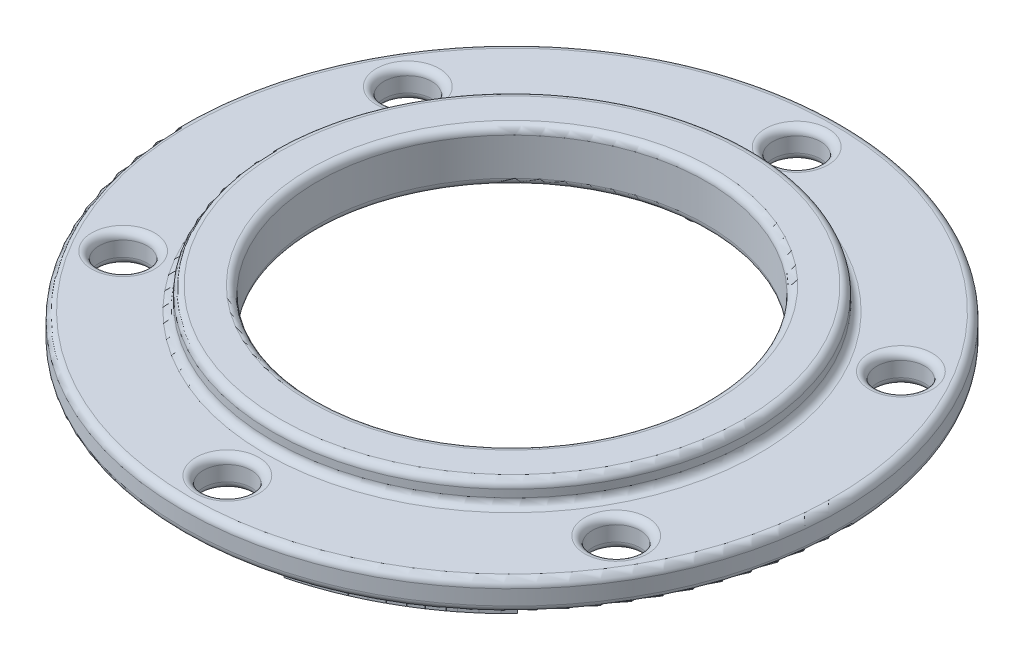
from build123d import *

# Parameters (mm, degrees)
SKETCH1_R                     = 22.025
SKETCH1_R_2                   = 1.6
SKETCH1_R_3                   = 13
BOSS_EXTRUDE1_DEPTH           = 2
BOSS_EXTRUDE2_START           = 1.5
SKETCH2_R                     = 16
SKETCH2_R_2                   = 13
BOSS_EXTRUDE2_DEPTH           = 1.5
FILLET1_R                     = 0.5
GL_FREE_BLUE_RAISED_START     = -2.6
GL_FREE_BLUE_RAISED_DEPTH     = 0.6
GL_FREE_BLUE_RAISED_2_DEPTH   = 0.6
GL_FREE_BLUE_RAISED_3_DEPTH   = 0.6
GL_FREE_BLUE_RAISED_4_DEPTH   = 0.6
GL_FREE_BLUE_RAISED_5_DEPTH   = 0.6
GL_FREE_BLUE_RAISED_6_DEPTH   = 0.6
GL_FREE_BLUE_RAISED_7_DEPTH   = 0.6
GL_FREE_BLUE_RAISED_8_DEPTH   = 0.6
GL_FREE_WHITE_RAISED_START    = -2.6
GL_FREE_WHITE_RAISED_DEPTH    = 0.6
GL_FREE_WHITE_RAISED_2_DEPTH  = 0.6
GL_FREE_WHITE_RAISED_3_DEPTH  = 0.6
GL_FREE_WHITE_RAISED_4_DEPTH  = 0.6
GL_FREE_WHITE_RAISED_5_DEPTH  = 0.6
GL_FREE_WHITE_RAISED_6_DEPTH  = 0.6
GL_FREE_WHITE_RAISED_7_DEPTH  = 0.6
GL_FREE_WHITE_RAISED_8_DEPTH  = 0.6
GL_FREE_WHITE_RAISED_9_DEPTH  = 0.6
GL_FREE_WHITE_RAISED_10_DEPTH = 0.6


with BuildPart() as part:
    # Sketch1 → Boss-Extrude1 (new body)
    with BuildSketch(Plane(origin=(0, 0, 0), x_dir=(1, 0, 0), z_dir=(0, 1, 0))):
        with Locations(Location((0, 0, 0), (0, 0, 270))):
            Circle(SKETCH1_R)
        with Locations(Location((0, 19.025, 0), (0, 0, 270))):
            Circle(SKETCH1_R_2, mode=Mode.SUBTRACT)
        with Locations(Location((16.476133307, 9.5125, 0), (0, 0, 270))):
            Circle(SKETCH1_R_2, mode=Mode.SUBTRACT)
        with Locations(Location((16.476133307, -9.5125, 0), (0, 0, 270))):
            Circle(SKETCH1_R_2, mode=Mode.SUBTRACT)
        with Locations(Location((0, -19.025, 0), (0, 0, 270))):
            Circle(SKETCH1_R_2, mode=Mode.SUBTRACT)
        with Locations(Location((-16.476133307, -9.5125, 0), (0, 0, 270))):
            Circle(SKETCH1_R_2, mode=Mode.SUBTRACT)
        with Locations(Location((-16.476133307, 9.5125, 0), (0, 0, 270))):
            Circle(SKETCH1_R_2, mode=Mode.SUBTRACT)
        with Locations(Location((0, 0, 0), (0, 0, 270))):
            Circle(SKETCH1_R_3, mode=Mode.SUBTRACT)
    extrude(amount=-BOSS_EXTRUDE1_DEPTH)

    # Sketch2 → Boss-Extrude2 (add)
    with BuildSketch(Plane(origin=(0, 0, 0), x_dir=(1, 0, 0), z_dir=(0, 1, 0)).offset(BOSS_EXTRUDE2_START)):
        with Locations(Location((0, 0, 0), (0, 0, 270))):
            Circle(SKETCH2_R)
        with Locations(Location((0, 0, 0), (0, 0, 270))):
            Circle(SKETCH2_R_2, mode=Mode.SUBTRACT)
    extrude(amount=-BOSS_EXTRUDE2_DEPTH)

    # Fillet1
    fillet1_edges = [part.edges().sort_by_distance(p)[0] for p in [
        (16.476133307, -2, -11.1125),
        (16.476133307, 0, -11.1125),
        (16.476133307, -2, 7.9125),
        (16.476133307, 0, 7.9125),
        (0, 0, -22.025),
        (0, -2, 17.425),
        (0, 0, 17.425),
        (-16.476133307, -2, 7.9125),
        (-16.476133307, 0, 7.9125),
        (-16.476133307, -2, -11.1125),
        (-16.476133307, 0, -11.1125),
        (0, 1.5, -16),
        (0, 0, -16),
        (0, 1.5, -13),
        (0, -2, -22.025),
        (0, -2, -20.625),
        (0, 0, -20.625),
        (0, -2, -13),
    ]]
    fillet(fillet1_edges, radius=FILLET1_R)


with BuildPart() as body_2:
    # GL_free_blue → GL_free_blue_raised (new body)
    with BuildSketch(Plane(origin=(0, 0, 0), x_dir=(1, 0, 0), z_dir=(0, 1, 0)).offset(GL_FREE_BLUE_RAISED_START)):
        Polygon((9.306505804, -18.929340893), (8.404430376, -19.346900421), (7.028369158, -16.963492476), (7.885734308, -16.468492476), align=None)
    extrude(amount=GL_FREE_BLUE_RAISED_DEPTH)


with BuildPart() as body_3:
    # GL_free_blue → GL_free_blue_raised 2 (new body)
    with BuildSketch(Plane(origin=(0, 0, 0), x_dir=(1, 0, 0), z_dir=(0, 1, 0)).offset(GL_FREE_BLUE_RAISED_START)):
        Polygon((10.115116312, -18.509895376), (8.023817425, -14.887659451), (8.881182575, -14.392659451), (10.97255353, -18.015020203), align=None)
    extrude(amount=GL_FREE_BLUE_RAISED_2_DEPTH)


with BuildPart() as body_4:
    # GL_free_blue → GL_free_blue_raised 3 (new body)
    with BuildSketch(Plane(origin=(0, 0, 0), x_dir=(1, 0, 0), z_dir=(0, 1, 0)).offset(GL_FREE_BLUE_RAISED_START)):
        Polygon((10.319265692, -15.063492476), (11.176630842, -14.568492476), (12.553308359, -16.952967881), (11.740662744, -17.525424387), align=None)
    extrude(amount=GL_FREE_BLUE_RAISED_3_DEPTH)


with BuildPart() as body_5:
    # GL_free_blue → GL_free_blue_raised 4 (new body)
    with BuildSketch(Plane(origin=(0, 0, 0), x_dir=(1, 0, 0), z_dir=(0, 1, 0)).offset(GL_FREE_BLUE_RAISED_START)):
        Polygon((-11.454743725, -8.409030696), (-9.965647, -11.432683505), (-9.316043074, -14.69680621), (-10.496553145, -16.446984363), (-10.541658153, -16.343465158), (-10.634823032, -16.204034063), (-10.820653706, -16.035606958), (-11.047374381, -15.928376064), (-11.211833718, -15.895663068), (-11.31723067, -15.893280096), (-10.367547128, -14.485316344), (-10.911227918, -11.75343505), (-12.33035591, -8.871855722), (-13.959785297, -5.99184903), (-13.098133158, -5.504349705), align=None)
    extrude(amount=GL_FREE_BLUE_RAISED_4_DEPTH)


with BuildPart() as body_6:
    # GL_free_blue → GL_free_blue_raised 5 (new body)
    with BuildSketch(Plane(origin=(0, 0, 0), x_dir=(1, 0, 0), z_dir=(0, 1, 0)).offset(GL_FREE_BLUE_RAISED_START)):
        Polygon((19.181745319, 0.248085644), (19.14496363, 0.000123636), (19.161404857, -0.166806945), (19.210079176, -0.327264669), (19.30525698, -0.495), (17.576993597, -0.495), (15.271986586, -2.385009565), (14.592384207, -4.230168005), (13.418796117, -7.134900457), (11.642134009, -9.768910353), (9.849364975, -11.500167284), (9.794031979, -11.275806365), (9.719576841, -11.1365106), (9.61938294, -11.014423978), (9.429824242, -10.873837666), (9.283929527, -10.813406097), (9.161662104, -10.788012272), (10.879572619, -9.129045372), (12.539863113, -6.667563489), (13.668709654, -3.873570256), (14.436055476, -1.790183464), (17.223006403, 0.495), (19.304713169, 0.495), (19.245916357, 0.403008233), align=None)
    extrude(amount=GL_FREE_BLUE_RAISED_5_DEPTH)


with BuildPart() as body_7:
    # GL_free_blue → GL_free_blue_raised 6 (new body)
    with BuildSketch(Plane(origin=(0, 0, 0), x_dir=(1, 0, 0), z_dir=(0, 1, 0)).offset(GL_FREE_BLUE_RAISED_START)):
        Polygon((-17.625462655, 0.445), (-17.105, 0.445), (-17.105, -0.445), (-17.625462655, -0.445), (-17.625462655, -1.405059589), (-17.057812186, -1.345397121), (-16.964781854, -2.230521608), (-17.625462655, -2.299961958), (-17.625462655, -3.158561136), (-17.390652701, -4.739248135), (-17.479251781, -4.694352334), (-17.630216032, -4.648557829), (-17.787268461, -4.633089515), (-17.944444526, -4.648570006), (-18.166650942, -4.728076733), (-18.297925035, -4.815791278), (-18.369906052, -4.88472279), (-18.615462655, -3.231691802), (-18.615462655, -2.404015151), (-19.540593563, -2.501250327), (-19.633623895, -1.616125841), (-18.615462655, -1.509112782), (-18.615462655, -0.445), (-19.695, -0.445), (-19.695, 0.445), (-18.615462655, 0.445), (-18.615462655, 1.509112782), (-19.633623895, 1.616125841), (-19.540593563, 2.501250327), (-18.615462655, 2.404015151), (-18.615462655, 3.231691802), (-18.369906052, 4.88472279), (-18.297925035, 4.815791278), (-18.166650942, 4.728076733), (-17.944444526, 4.648570006), (-17.787268461, 4.633089515), (-17.630216032, 4.648557829), (-17.479251781, 4.694352334), (-17.390652701, 4.739248135), (-17.625462655, 3.158561136), (-17.625462655, 2.299961958), (-16.964781854, 2.230521608), (-17.057812186, 1.345397121), (-17.625462655, 1.405059589), align=None)
    extrude(amount=GL_FREE_BLUE_RAISED_6_DEPTH)


with BuildPart() as body_8:
    # GL_free_blue → GL_free_blue_raised 7 (new body)
    with BuildSketch(Plane(origin=(0, 0, 0), x_dir=(1, 0, 0), z_dir=(0, 1, 0)).offset(GL_FREE_BLUE_RAISED_START)):
        Polygon((-2.816260125, 14.790458916), (-2.850899294, 14.556940611), (-2.816233908, 14.323245564), (-2.715276551, 14.109789166), (-2.615118362, 13.98774606), (-2.540308097, 13.923503264), (-4.944467222, 13.324079071), (-6.756642728, 13.155872159), (-9.207986219, 14.363568545), (-10.160715765, 15.949176781), (-10.010932687, 15.94957338), (-9.846423999, 15.982296192), (-9.619703324, 16.089527086), (-9.433785183, 16.258033467), (-9.31233374, 16.459419969), (-8.509323558, 15.122986599), (-6.569840134, 14.167466848), (-5.110924992, 14.30288398), (-2.779774399, 14.884105102), align=None)
    extrude(amount=GL_FREE_BLUE_RAISED_7_DEPTH)


with BuildPart() as body_9:
    # GL_free_blue → GL_free_blue_raised 8 (new body)
    with BuildSketch(Plane(origin=(0, 0, 0), x_dir=(1, 0, 0), z_dir=(0, 1, 0)).offset(GL_FREE_BLUE_RAISED_START)):
        Polygon((10.862913594, 13.521440954), (10.671161847, 13.512020794), (10.548164936, 13.474710089), (10.434810335, 13.414120793), (10.292419316, 13.285065096), (10.189697867, 13.103326934), (9.576801131, 14.819206159), (9.453289815, 16.479705424), (9.666172454, 16.376970991), (9.821093831, 16.346155214), (9.979030403, 16.346155214), (10.207959857, 16.403499056), (10.347223649, 16.477937104), (10.440580756, 16.552894621), (10.554143394, 15.026146453), (11.121752455, 13.4370556), (10.98904352, 13.496352151), align=None)
    extrude(amount=GL_FREE_BLUE_RAISED_8_DEPTH)


with BuildPart() as body_10:
    # GL_free_white → GL_free_white_raised (new body)
    with BuildSketch(Plane(origin=(0, 0, 0), x_dir=(1, 0, 0), z_dir=(0, 1, 0)).offset(GL_FREE_WHITE_RAISED_START)):
        Polygon((-10.698208527, -17.344047089), (-10.826253244, -17.449130672), (-10.972338408, -17.527214819), (-11.130850048, -17.5752988), (-11.29569665, -17.591534773), (-11.460543252, -17.5752988), (-11.619054892, -17.527214819), (-11.765140056, -17.449130672), (-11.893184773, -17.344047089), (-11.998268357, -17.216002372), (-12.076352504, -17.069917208), (-12.124436484, -16.911405568), (-12.140672457, -16.746558966), (-12.124436484, -16.581712363), (-12.076352504, -16.423200723), (-11.998268357, -16.27711556), (-11.893184773, -16.149070842), (-11.765140056, -16.043987259), (-11.619054892, -15.965903112), (-11.460543252, -15.917819132), (-11.29569665, -15.901583158), (-11.130850048, -15.917819132), (-10.972338408, -15.965903112), (-10.826253244, -16.043987259), (-10.698208527, -16.149070842), (-10.593124943, -16.27711556), (-10.515040796, -16.423200723), (-10.466956816, -16.581712363), (-10.450720843, -16.746558966), (-10.466956816, -16.911405568), (-10.515040796, -17.069917208), (-10.593124943, -17.216002372), align=None)
    extrude(amount=GL_FREE_WHITE_RAISED_DEPTH)


with BuildPart() as body_11:
    # GL_free_white → GL_free_white_raised 2 (new body)
    with BuildSketch(Plane(origin=(0, 0, 0), x_dir=(1, 0, 0), z_dir=(0, 1, 0)).offset(GL_FREE_WHITE_RAISED_START)):
        Polygon((11.73234578, -17.531018984), (10.981102088, -18.009826739), (8.884842829, -14.378999197), (8.010157171, -14.883999197), (10.106340425, -18.514695096), (9.315512233, -18.924940485), (7.889394562, -16.454832222), (7.014708904, -16.959832222), (8.395197271, -19.350908213), (7.591990583, -19.681479779), (6.617086942, -20.03030588), (6.123582116, -20.186647481), (5.203599922, -20.44219456), (4.45716948, -16.615911359), (7.952531945, -13.774189377), (12.161216604, -12.167977678), (15.101080054, -14.72704232), (14.545863913, -15.277984634), (13.778680138, -15.973319476), (12.978286782, -16.630185328), (12.561415496, -16.947009855), (11.180291096, -14.554832222), (10.305605438, -15.059832222), align=None)
    extrude(amount=GL_FREE_WHITE_RAISED_2_DEPTH)


with BuildPart() as body_12:
    # GL_free_white → GL_free_white_raised 3 (new body)
    with BuildSketch(Plane(origin=(0, 0, 0), x_dir=(1, 0, 0), z_dir=(0, 1, 0)).offset(GL_FREE_WHITE_RAISED_START)):
        Polygon((9.612356471, -12.145890862), (9.491888582, -12.244756304), (9.354447758, -12.318219955), (9.205315773, -12.363458648), (9.050223687, -12.378733885), (8.895131601, -12.363458648), (8.745999617, -12.318219955), (8.608558793, -12.244756304), (8.488090903, -12.145890862), (8.389225461, -12.025422972), (8.31576181, -11.887982149), (8.270523117, -11.738850164), (8.25524788, -11.583758078), (8.270523117, -11.428665992), (8.31576181, -11.279534007), (8.389225461, -11.142093184), (8.488090903, -11.021625294), (8.608558793, -10.922759852), (8.745999617, -10.849296201), (8.895131601, -10.804057508), (9.050223687, -10.788782271), (9.205315773, -10.804057508), (9.354447758, -10.849296201), (9.491888582, -10.922759852), (9.612356471, -11.021625294), (9.711221913, -11.142093184), (9.784685564, -11.279534007), (9.829924257, -11.428665992), (9.845199494, -11.583758078), (9.829924257, -11.738850164), (9.784685564, -11.887982149), (9.711221913, -12.025422972), align=None)
    extrude(amount=GL_FREE_WHITE_RAISED_3_DEPTH)


with BuildPart() as body_13:
    # GL_free_white → GL_free_white_raised 4 (new body)
    with BuildSketch(Plane(origin=(0, 0, 0), x_dir=(1, 0, 0), z_dir=(0, 1, 0)).offset(GL_FREE_WHITE_RAISED_START)):
        Polygon((-17.345603566, -6.099111934), (-17.48304439, -6.172575585), (-17.632176375, -6.217814278), (-17.787268461, -6.233089515), (-17.942360547, -6.217814278), (-18.091492531, -6.172575585), (-18.228933355, -6.099111934), (-18.349401245, -6.000246492), (-18.448266687, -5.879778602), (-18.521730338, -5.742337778), (-18.566969031, -5.593205794), (-18.582244268, -5.438113708), (-18.566969031, -5.283021622), (-18.521730338, -5.133889637), (-18.448266687, -4.996448813), (-18.349401245, -4.875980924), (-18.228933355, -4.777115482), (-18.091492531, -4.703651831), (-17.942360547, -4.658413138), (-17.787268461, -4.643137901), (-17.632176375, -4.658413138), (-17.48304439, -4.703651831), (-17.345603566, -4.777115482), (-17.225135677, -4.875980924), (-17.126270235, -4.996448813), (-17.052806584, -5.133889637), (-17.007567891, -5.283021622), (-16.992292654, -5.438113708), (-17.007567891, -5.593205794), (-17.052806584, -5.742337778), (-17.126270235, -5.879778602), (-17.225135677, -6.000246492), align=None)
    extrude(amount=GL_FREE_WHITE_RAISED_4_DEPTH)


with BuildPart() as body_14:
    # GL_free_white → GL_free_white_raised 5 (new body)
    with BuildSketch(Plane(origin=(0, 0, 0), x_dir=(1, 0, 0), z_dir=(0, 1, 0)).offset(GL_FREE_WHITE_RAISED_START)):
        Polygon((20.469443406, -0.702571707), (20.323358242, -0.780655854), (20.164846602, -0.828739834), (20, -0.844975807), (19.835153398, -0.828739834), (19.676641758, -0.780655854), (19.530556594, -0.702571707), (19.402511877, -0.597488123), (19.297428293, -0.469443406), (19.219344146, -0.323358242), (19.171260166, -0.164846602), (19.155024193, 0), (19.171260166, 0.164846602), (19.219344146, 0.323358242), (19.297428293, 0.469443406), (19.402511877, 0.597488123), (19.530556594, 0.702571707), (19.676641758, 0.780655854), (19.835153398, 0.828739834), (20, 0.844975807), (20.164846602, 0.828739834), (20.323358242, 0.780655854), (20.469443406, 0.702571707), (20.597488123, 0.597488123), (20.702571707, 0.469443406), (20.780655854, 0.323358242), (20.828739834, 0.164846602), (20.844975807, 0), (20.828739834, -0.164846602), (20.780655854, -0.323358242), (20.702571707, -0.469443406), (20.597488123, -0.597488123), align=None)
    extrude(amount=GL_FREE_WHITE_RAISED_5_DEPTH)


with BuildPart() as body_15:
    # GL_free_white → GL_free_white_raised 6 (new body)
    with BuildSketch(Plane(origin=(0, 0, 0), x_dir=(1, 0, 0), z_dir=(0, 1, 0)).offset(GL_FREE_WHITE_RAISED_START)):
        Polygon((-17.225135677, 4.875980924), (-17.345603566, 4.777115482), (-17.48304439, 4.703651831), (-17.632176375, 4.658413138), (-17.787268461, 4.643137901), (-17.942360547, 4.658413138), (-18.091492531, 4.703651831), (-18.228933355, 4.777115482), (-18.349401245, 4.875980924), (-18.448266687, 4.996448813), (-18.521730338, 5.133889637), (-18.566969031, 5.283021622), (-18.582244268, 5.438113708), (-18.566969031, 5.593205794), (-18.521730338, 5.742337778), (-18.448266687, 5.879778602), (-18.349401245, 6.000246492), (-18.228933355, 6.099111934), (-18.091492531, 6.172575585), (-17.942360547, 6.217814278), (-17.787268461, 6.233089515), (-17.632176375, 6.217814278), (-17.48304439, 6.172575585), (-17.345603566, 6.099111934), (-17.225135677, 6.000246492), (-17.126270235, 5.879778602), (-17.052806584, 5.742337778), (-17.007567891, 5.593205794), (-16.992292654, 5.438113708), (-17.007567891, 5.283021622), (-17.052806584, 5.133889637), (-17.126270235, 4.996448813), align=None)
    extrude(amount=GL_FREE_WHITE_RAISED_6_DEPTH)


with BuildPart() as body_16:
    # GL_free_white → GL_free_white_raised 7 (new body)
    with BuildSketch(Plane(origin=(0, 0, 0), x_dir=(1, 0, 0), z_dir=(0, 1, 0)).offset(GL_FREE_WHITE_RAISED_START)):
        Polygon((11.25489861, 12.413479877), (11.157161202, 12.33326886), (11.045653398, 12.273666697), (10.924660381, 12.236963867), (10.798831843, 12.224570837), (10.673003305, 12.236963867), (10.552010287, 12.273666697), (10.440502483, 12.33326886), (10.342765076, 12.413479877), (10.262554058, 12.511217285), (10.202951896, 12.622725089), (10.166249065, 12.743718106), (10.153856036, 12.869546644), (10.166249065, 12.995375182), (10.202951896, 13.1163682), (10.262554058, 13.227876004), (10.342765076, 13.325613411), (10.440502483, 13.405824429), (10.552010287, 13.465426592), (10.673003305, 13.502129422), (10.798831843, 13.514522452), (10.924660381, 13.502129422), (11.045653398, 13.465426592), (11.157161202, 13.405824429), (11.25489861, 13.325613411), (11.335109627, 13.227876004), (11.39471179, 13.1163682), (11.431414621, 12.995375182), (11.44380765, 12.869546644), (11.431414621, 12.743718106), (11.39471179, 12.622725089), (11.335109627, 12.511217285), align=None)
    extrude(amount=GL_FREE_WHITE_RAISED_7_DEPTH)


with BuildPart() as body_17:
    # GL_free_white → GL_free_white_raised 8 (new body)
    with BuildSketch(Plane(origin=(0, 0, 0), x_dir=(1, 0, 0), z_dir=(0, 1, 0)).offset(GL_FREE_WHITE_RAISED_START)):
        Polygon((-1.4837118, 13.994807826), (-1.60417969, 13.895942384), (-1.741620514, 13.822478733), (-1.890752498, 13.777240041), (-2.045844584, 13.761964803), (-2.20093667, 13.777240041), (-2.350068655, 13.822478733), (-2.487509479, 13.895942384), (-2.607977368, 13.994807826), (-2.70684281, 14.115275716), (-2.780306461, 14.25271654), (-2.825545154, 14.401848524), (-2.840820391, 14.556940611), (-2.825545154, 14.712032697), (-2.780306461, 14.861164681), (-2.70684281, 14.998605505), (-2.607977368, 15.119073395), (-2.487509479, 15.217938837), (-2.350068655, 15.291402488), (-2.20093667, 15.33664118), (-2.045844584, 15.351916418), (-1.890752498, 15.33664118), (-1.741620514, 15.291402488), (-1.60417969, 15.217938837), (-1.4837118, 15.119073395), (-1.384846358, 14.998605505), (-1.311382707, 14.861164681), (-1.266144014, 14.712032697), (-1.250868777, 14.556940611), (-1.266144014, 14.401848524), (-1.311382707, 14.25271654), (-1.384846358, 14.115275716), align=None)
    extrude(amount=GL_FREE_WHITE_RAISED_8_DEPTH)


with BuildPart() as body_18:
    # GL_free_white → GL_free_white_raised 9 (new body)
    with BuildSketch(Plane(origin=(0, 0, 0), x_dir=(1, 0, 0), z_dir=(0, 1, 0)).offset(GL_FREE_WHITE_RAISED_START)):
        Polygon((-9.625302862, 16.097907387), (-9.771388026, 16.01982324), (-9.929899666, 15.97173926), (-10.094746268, 15.955503287), (-10.259592871, 15.97173926), (-10.41810451, 16.01982324), (-10.564189674, 16.097907387), (-10.692234391, 16.202990971), (-10.797317975, 16.331035688), (-10.875402122, 16.477120852), (-10.923486102, 16.635632491), (-10.939722075, 16.800479094), (-10.923486102, 16.965325696), (-10.875402122, 17.123837336), (-10.797317975, 17.2699225), (-10.692234391, 17.397967217), (-10.564189674, 17.503050801), (-10.41810451, 17.581134947), (-10.259592871, 17.629218928), (-10.094746268, 17.645454901), (-9.929899666, 17.629218928), (-9.771388026, 17.581134947), (-9.625302862, 17.503050801), (-9.497258145, 17.397967217), (-9.392174561, 17.2699225), (-9.314090415, 17.123837336), (-9.266006434, 16.965325696), (-9.249770461, 16.800479094), (-9.266006434, 16.635632491), (-9.314090415, 16.477120852), (-9.392174561, 16.331035688), (-9.497258145, 16.202990971), align=None)
    extrude(amount=GL_FREE_WHITE_RAISED_9_DEPTH)


with BuildPart() as body_19:
    # GL_free_white → GL_free_white_raised 10 (new body)
    with BuildSketch(Plane(origin=(0, 0, 0), x_dir=(1, 0, 0), z_dir=(0, 1, 0)).offset(GL_FREE_WHITE_RAISED_START)):
        Polygon((10.341664894, 16.486304769), (10.204224071, 16.412841118), (10.055092086, 16.367602425), (9.9, 16.352327188), (9.744907914, 16.367602425), (9.595775929, 16.412841118), (9.458335106, 16.486304769), (9.337867216, 16.585170211), (9.239001774, 16.705638101), (9.165538123, 16.843078924), (9.12029943, 16.992210909), (9.105024193, 17.147302995), (9.12029943, 17.302395081), (9.165538123, 17.451527065), (9.239001774, 17.588967889), (9.337867216, 17.709435779), (9.458335106, 17.808301221), (9.595775929, 17.881764872), (9.744907914, 17.927003565), (9.9, 17.942278802), (10.055092086, 17.927003565), (10.204224071, 17.881764872), (10.341664894, 17.808301221), (10.462132784, 17.709435779), (10.560998226, 17.588967889), (10.634461877, 17.451527065), (10.67970057, 17.302395081), (10.694975807, 17.147302995), (10.67970057, 16.992210909), (10.634461877, 16.843078924), (10.560998226, 16.705638101), (10.462132784, 16.585170211), align=None)
    extrude(amount=GL_FREE_WHITE_RAISED_10_DEPTH)


solid = Compound([part.part, body_2.part, body_3.part, body_4.part, body_5.part, body_6.part, body_7.part, body_8.part, body_9.part, body_10.part, body_11.part, body_12.part, body_13.part, body_14.part, body_15.part, body_16.part, body_17.part, body_18.part, body_19.part])
